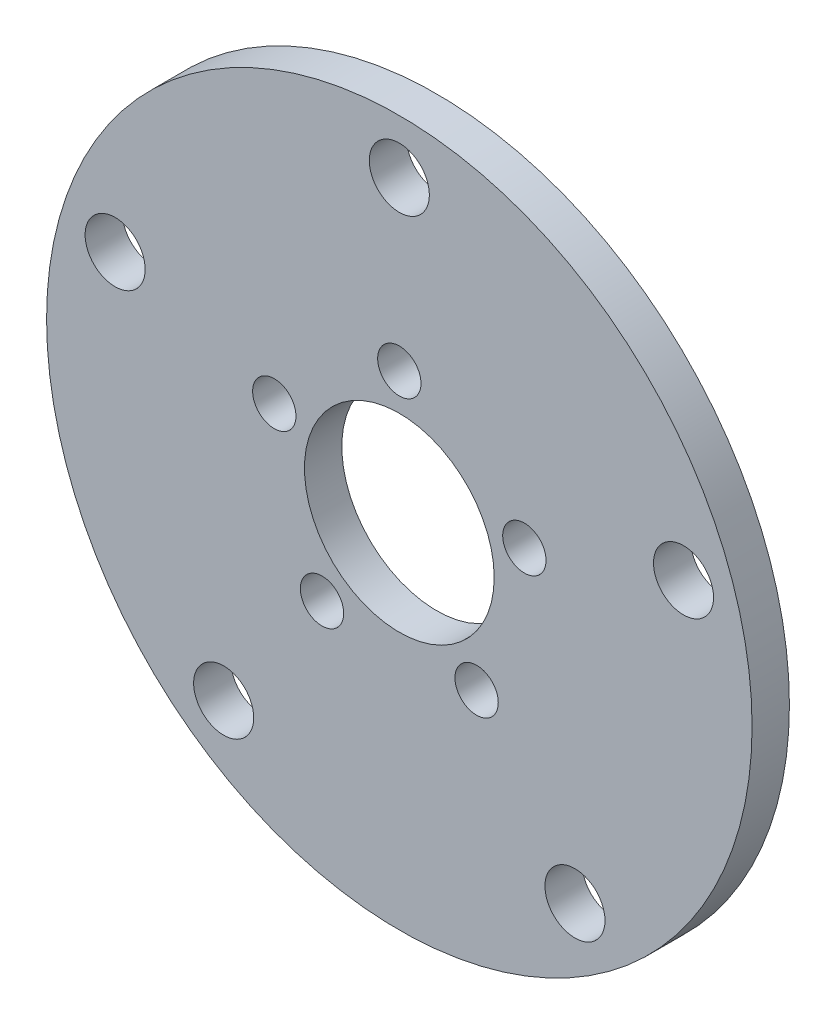
from build123d import *

# Parameters (mm, degrees)
SKETCH1_R           = 29.9847
SKETCH1_R_2         = 8.0645
SKETCH1_R_3         = 1.8415
SKETCH1_R_4         = 2.5527
BOSS_EXTRUDE1_DEPTH = 3.175


with BuildPart() as part:
    # Sketch1 → Boss-Extrude1 (new body)
    with BuildSketch(Plane.XY):
        Circle(SKETCH1_R)
        Circle(SKETCH1_R_2, mode=Mode.SUBTRACT)
        with Locations((0, 11.176)):
            Circle(SKETCH1_R_3, mode=Mode.SUBTRACT)
        with Locations((0, 25.4)):
            Circle(SKETCH1_R_4, mode=Mode.SUBTRACT)
        with Locations((10.629007626, 3.453573929)):
            Circle(SKETCH1_R_3, mode=Mode.SUBTRACT)
        with Locations((24.156835514, 7.849031657)):
            Circle(SKETCH1_R_4, mode=Mode.SUBTRACT)
        with Locations((6.56908798, -9.041573929)):
            Circle(SKETCH1_R_3, mode=Mode.SUBTRACT)
        with Locations((14.929745408, -20.549031657)):
            Circle(SKETCH1_R_4, mode=Mode.SUBTRACT)
        with Locations((-6.56908798, -9.041573929)):
            Circle(SKETCH1_R_3, mode=Mode.SUBTRACT)
        with Locations((-14.929745408, -20.549031657)):
            Circle(SKETCH1_R_4, mode=Mode.SUBTRACT)
        with Locations((-10.629007626, 3.453573929)):
            Circle(SKETCH1_R_3, mode=Mode.SUBTRACT)
        with Locations((-24.156835514, 7.849031657)):
            Circle(SKETCH1_R_4, mode=Mode.SUBTRACT)
    extrude(amount=BOSS_EXTRUDE1_DEPTH)


solid = part.part
